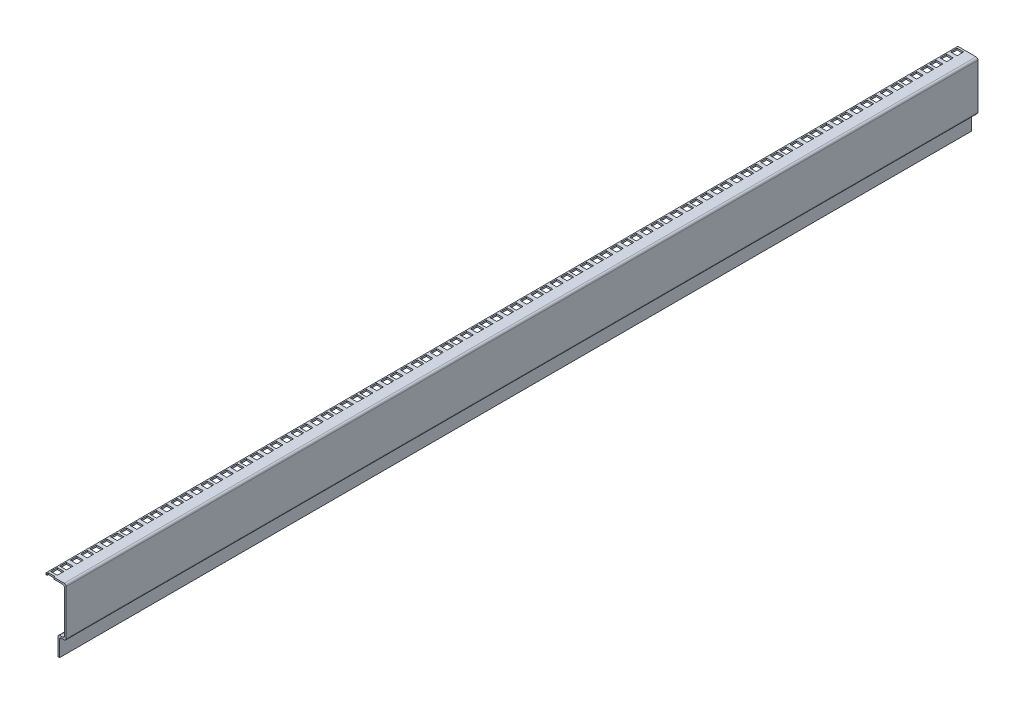
from build123d import *

# Parameters (mm, degrees)
SKETCH1_W            = 101.5
SKETCH1_H            = 1385.86
BOSS_EXTRUDE1_DEPTH  = 30.6
SKETCH2_W            = 28.1
SKETCH2_H            = 99
CUT_EXTRUDE1_DEPTH   = 1390.595401403
SKETCH3_W            = 1385.86
SKETCH3_H            = 29.5
BOSS_EXTRUDE2_DEPTH  = 10
SKETCH4_W            = 10
SKETCH4_H            = 27
CUT_EXTRUDE2_DEPTH   = 1390.595401403
SKETCH5_W            = 10
SKETCH5_H            = 474.14
CUT_EXTRUDE3_DEPTH   = 941.794180467
SKETCH37_W           = 10
SKETCH37_H           = 10
CUT_EXTRUDE35_DEPTH  = 941.794180467
SKETCH38_W           = 10
SKETCH38_H           = 10
CUT_EXTRUDE36_DEPTH  = 941.794180467
SKETCH39_W           = 10
SKETCH39_H           = 10
CUT_EXTRUDE37_DEPTH  = 941.794180467
SKETCH40_W           = 10
SKETCH40_H           = 10
CUT_EXTRUDE38_DEPTH  = 941.794180467
SKETCH41_W           = 10
SKETCH41_H           = 10
CUT_EXTRUDE39_DEPTH  = 941.794180467
SKETCH42_W           = 10
SKETCH42_H           = 10
CUT_EXTRUDE40_DEPTH  = 941.794180467
SKETCH43_W           = 10
SKETCH43_H           = 10
CUT_EXTRUDE41_DEPTH  = 941.794180467
SKETCH44_W           = 10
SKETCH44_H           = 10
CUT_EXTRUDE42_DEPTH  = 941.794180467
SKETCH45_W           = 10
SKETCH45_H           = 10
CUT_EXTRUDE43_DEPTH  = 941.794180467
SKETCH46_W           = 10
SKETCH46_H           = 10
CUT_EXTRUDE44_DEPTH  = 941.794180467
SKETCH47_W           = 10
SKETCH47_H           = 10
CUT_EXTRUDE45_DEPTH  = 941.794180467
SKETCH48_W           = 10
SKETCH48_H           = 10
CUT_EXTRUDE46_DEPTH  = 941.794180467
SKETCH49_W           = 10
SKETCH49_H           = 10
CUT_EXTRUDE47_DEPTH  = 941.794180467
SKETCH50_W           = 10
SKETCH50_H           = 10
CUT_EXTRUDE48_DEPTH  = 941.794180467
SKETCH51_W           = 10
SKETCH51_H           = 10
CUT_EXTRUDE49_DEPTH  = 941.794180467
SKETCH52_W           = 10
SKETCH52_H           = 10
CUT_EXTRUDE50_DEPTH  = 941.794180467
SKETCH53_W           = 10
SKETCH53_H           = 10
CUT_EXTRUDE51_DEPTH  = 941.794180467
SKETCH54_W           = 10
SKETCH54_H           = 10
CUT_EXTRUDE52_DEPTH  = 941.794180467
SKETCH55_W           = 10
SKETCH55_H           = 10
CUT_EXTRUDE53_DEPTH  = 941.794180467
SKETCH56_W           = 10
SKETCH56_H           = 10
CUT_EXTRUDE54_DEPTH  = 941.794180467
SKETCH57_W           = 10
SKETCH57_H           = 10
CUT_EXTRUDE55_DEPTH  = 941.794180467
SKETCH58_W           = 10
SKETCH58_H           = 10
CUT_EXTRUDE56_DEPTH  = 941.794180467
SKETCH59_W           = 10
SKETCH59_H           = 10
CUT_EXTRUDE57_DEPTH  = 941.794180467
SKETCH60_W           = 10
SKETCH60_H           = 10
CUT_EXTRUDE58_DEPTH  = 941.794180467
SKETCH61_W           = 10
SKETCH61_H           = 10
CUT_EXTRUDE59_DEPTH  = 941.794180467
SKETCH62_W           = 10
SKETCH62_H           = 10
CUT_EXTRUDE60_DEPTH  = 941.794180467
SKETCH63_W           = 10
SKETCH63_H           = 10
CUT_EXTRUDE61_DEPTH  = 941.794180467
SKETCH64_W           = 10
SKETCH64_H           = 10
CUT_EXTRUDE62_DEPTH  = 941.794180467
SKETCH65_W           = 10
SKETCH65_H           = 10
CUT_EXTRUDE63_DEPTH  = 941.794180467
SKETCH66_W           = 10
SKETCH66_H           = 10
CUT_EXTRUDE64_DEPTH  = 941.794180467
SKETCH67_W           = 10
SKETCH67_H           = 10
CUT_EXTRUDE65_DEPTH  = 941.794180467
SKETCH68_W           = 10
SKETCH68_H           = 10
CUT_EXTRUDE66_DEPTH  = 941.794180467
SKETCH69_W           = 10
SKETCH69_H           = 10
CUT_EXTRUDE67_DEPTH  = 941.794180467
SKETCH70_W           = 10
SKETCH70_H           = 10
CUT_EXTRUDE68_DEPTH  = 941.794180467
SKETCH71_W           = 10
SKETCH71_H           = 10
CUT_EXTRUDE69_DEPTH  = 941.794180467
SKETCH72_W           = 10
SKETCH72_H           = 10
CUT_EXTRUDE70_DEPTH  = 941.794180467
SKETCH73_W           = 10
SKETCH73_H           = 10
CUT_EXTRUDE71_DEPTH  = 941.794180467
SKETCH74_W           = 10
SKETCH74_H           = 10
CUT_EXTRUDE72_DEPTH  = 941.794180467
SKETCH75_W           = 10
SKETCH75_H           = 10
CUT_EXTRUDE73_DEPTH  = 941.794180467
SKETCH76_W           = 10
SKETCH76_H           = 10
CUT_EXTRUDE74_DEPTH  = 941.794180467
SKETCH77_W           = 10
SKETCH77_H           = 10
CUT_EXTRUDE75_DEPTH  = 941.794180467
SKETCH78_W           = 10
SKETCH78_H           = 10
CUT_EXTRUDE76_DEPTH  = 941.794180467
SKETCH79_W           = 10
SKETCH79_H           = 10
CUT_EXTRUDE77_DEPTH  = 941.794180467
SKETCH80_W           = 10
SKETCH80_H           = 10
CUT_EXTRUDE78_DEPTH  = 941.794180467
SKETCH81_W           = 10
SKETCH81_H           = 10
CUT_EXTRUDE79_DEPTH  = 941.794180467
SKETCH82_W           = 10
SKETCH82_H           = 10
CUT_EXTRUDE80_DEPTH  = 941.794180467
SKETCH83_W           = 10
SKETCH83_H           = 10
CUT_EXTRUDE81_DEPTH  = 941.794180467
SKETCH84_W           = 10
SKETCH84_H           = 10
CUT_EXTRUDE82_DEPTH  = 941.794180467
SKETCH85_W           = 10
SKETCH85_H           = 10
CUT_EXTRUDE83_DEPTH  = 941.794180467
SKETCH86_W           = 10
SKETCH86_H           = 10
CUT_EXTRUDE84_DEPTH  = 941.794180467
SKETCH87_W           = 10
SKETCH87_H           = 10
CUT_EXTRUDE85_DEPTH  = 941.794180467
SKETCH88_W           = 10
SKETCH88_H           = 10
CUT_EXTRUDE86_DEPTH  = 941.794180467
SKETCH89_W           = 10
SKETCH89_H           = 10
CUT_EXTRUDE87_DEPTH  = 941.794180467
SKETCH90_W           = 10
SKETCH90_H           = 10
CUT_EXTRUDE88_DEPTH  = 941.794180467
SKETCH91_W           = 10
SKETCH91_H           = 10
CUT_EXTRUDE89_DEPTH  = 941.794180467
SKETCH92_W           = 10
SKETCH92_H           = 10
CUT_EXTRUDE90_DEPTH  = 941.794180467
SKETCH93_W           = 10
SKETCH93_H           = 10
CUT_EXTRUDE91_DEPTH  = 941.794180467
SKETCH94_W           = 10
SKETCH94_H           = 10
CUT_EXTRUDE92_DEPTH  = 941.794180467
SKETCH95_W           = 10
SKETCH95_H           = 10
CUT_EXTRUDE93_DEPTH  = 941.794180467
SKETCH96_W           = 10
SKETCH96_H           = 10
CUT_EXTRUDE94_DEPTH  = 941.794180467
SKETCH97_W           = 10
SKETCH97_H           = 10
CUT_EXTRUDE95_DEPTH  = 941.794180467
SKETCH98_W           = 10
SKETCH98_H           = 10
CUT_EXTRUDE96_DEPTH  = 941.794180467
SKETCH99_W           = 10
SKETCH99_H           = 10
CUT_EXTRUDE97_DEPTH  = 941.794180467
SKETCH100_W          = 10
SKETCH100_H          = 10
CUT_EXTRUDE98_DEPTH  = 941.794180467
SKETCH101_W          = 10
SKETCH101_H          = 10
CUT_EXTRUDE99_DEPTH  = 941.794180467
SKETCH102_W          = 10
SKETCH102_H          = 10
CUT_EXTRUDE100_DEPTH = 941.794180467
SKETCH103_W          = 10
SKETCH103_H          = 10
CUT_EXTRUDE101_DEPTH = 941.794180467
SKETCH104_W          = 10
SKETCH104_H          = 10
CUT_EXTRUDE102_DEPTH = 941.794180467
SKETCH105_W          = 10
SKETCH105_H          = 10
CUT_EXTRUDE103_DEPTH = 941.794180467
SKETCH106_W          = 10
SKETCH106_H          = 10
CUT_EXTRUDE104_DEPTH = 941.794180467
SKETCH107_W          = 10
SKETCH107_H          = 10
CUT_EXTRUDE105_DEPTH = 941.794180467
SKETCH108_W          = 10
SKETCH108_H          = 10
CUT_EXTRUDE106_DEPTH = 941.794180467
SKETCH109_W          = 10
SKETCH109_H          = 10
CUT_EXTRUDE107_DEPTH = 941.794180467
SKETCH110_W          = 10
SKETCH110_H          = 10
CUT_EXTRUDE108_DEPTH = 941.794180467
SKETCH111_W          = 10
SKETCH111_H          = 10
CUT_EXTRUDE109_DEPTH = 941.794180467
SKETCH112_W          = 10
SKETCH112_H          = 10
CUT_EXTRUDE110_DEPTH = 941.794180467
SKETCH113_W          = 10
SKETCH113_H          = 10
CUT_EXTRUDE111_DEPTH = 941.794180467
SKETCH114_W          = 10
SKETCH114_H          = 10
CUT_EXTRUDE112_DEPTH = 941.794180467
SKETCH115_W          = 10
SKETCH115_H          = 10
CUT_EXTRUDE113_DEPTH = 941.794180467
SKETCH116_W          = 10
SKETCH116_H          = 10
CUT_EXTRUDE114_DEPTH = 941.794180467
SKETCH117_W          = 10
SKETCH117_H          = 10
CUT_EXTRUDE115_DEPTH = 941.794180467
SKETCH118_W          = 10
SKETCH118_H          = 10
CUT_EXTRUDE116_DEPTH = 941.794180467
SKETCH119_W          = 10
SKETCH119_H          = 10
CUT_EXTRUDE117_DEPTH = 941.794180467
SKETCH120_W          = 10
SKETCH120_H          = 10
CUT_EXTRUDE118_DEPTH = 941.794180467
SKETCH121_W          = 10
SKETCH121_H          = 10
CUT_EXTRUDE119_DEPTH = 941.794180467
SKETCH122_W          = 10
SKETCH122_H          = 10
CUT_EXTRUDE120_DEPTH = 941.794180467
SKETCH123_W          = 10
SKETCH123_H          = 10
CUT_EXTRUDE121_DEPTH = 941.794180467
SKETCH124_W          = 10
SKETCH124_H          = 10
CUT_EXTRUDE122_DEPTH = 941.794180467
SKETCH125_W          = 10
SKETCH125_H          = 10
CUT_EXTRUDE123_DEPTH = 941.794180467
SKETCH126_W          = 10
SKETCH126_H          = 10
CUT_EXTRUDE124_DEPTH = 941.794180467
SKETCH127_W          = 10
SKETCH127_H          = 10
CUT_EXTRUDE125_DEPTH = 941.527745471
FILLET1_R            = 3


with BuildPart() as part:
    # Sketch1 → Boss-Extrude1 (new body)
    with BuildSketch(Plane(origin=(-6.8, 0, 0), x_dir=(0, -1, 0), z_dir=(-1, 0, 0))):
        with Locations((48.25, -242.07)):
            Rectangle(SKETCH1_W, SKETCH1_H)
    extrude(amount=-BOSS_EXTRUDE1_DEPTH)

    # Sketch2 → Cut-Extrude1 (cut, through all)
    with BuildSketch(Plane(origin=(0, 0, -935), x_dir=(-1, 0, 0), z_dir=(0, 0, -1))):
        with Locations((-7.25, -49.5)):
            Rectangle(SKETCH2_W, SKETCH2_H)
    extrude(amount=-CUT_EXTRUDE1_DEPTH, mode=Mode.SUBTRACT)

    # Sketch3 → Boss-Extrude2 (add)
    with BuildSketch(Plane.ZY.offset(-21.3)):
        with Locations((-242.07, -84.25)):
            Rectangle(SKETCH3_W, SKETCH3_H)
    extrude(amount=BOSS_EXTRUDE2_DEPTH)

    # Sketch4 → Cut-Extrude2 (cut, through all)
    with BuildSketch(Plane.XY.offset(450.86)):
        with Locations((18.8, -85.5)):
            Rectangle(SKETCH4_W, SKETCH4_H)
    extrude(amount=-CUT_EXTRUDE2_DEPTH, mode=Mode.SUBTRACT)

    # Sketch5 → Cut-Extrude3 (cut, through all)
    with BuildSketch(Plane(origin=(0, 2.5, 0), x_dir=(-1, 0, 0), z_dir=(0, 1, 0))):
        with Locations((0, 686.08)):
            Rectangle(SKETCH5_W, SKETCH5_H)
    extrude(amount=-CUT_EXTRUDE3_DEPTH, mode=Mode.SUBTRACT)

    # Sketch37 → Cut-Extrude35 (cut, through all)
    with BuildSketch(Plane(origin=(0, 2.5, 0), x_dir=(-1, 0, 0), z_dir=(0, 1, 0))):
        with Locations((0, 440.546341463)):
            Rectangle(SKETCH37_W, SKETCH37_H)
    extrude(amount=-CUT_EXTRUDE35_DEPTH, mode=Mode.SUBTRACT)

    # Sketch38 → Cut-Extrude36 (cut, through all)
    with BuildSketch(Plane(origin=(0, 2.5, 0), x_dir=(-1, 0, 0), z_dir=(0, 1, 0))):
        with Locations((0, 426.71097561)):
            Rectangle(SKETCH38_W, SKETCH38_H)
    extrude(amount=-CUT_EXTRUDE36_DEPTH, mode=Mode.SUBTRACT)

    # Sketch39 → Cut-Extrude37 (cut, through all)
    with BuildSketch(Plane(origin=(0, 2.5, 0), x_dir=(-1, 0, 0), z_dir=(0, 1, 0))):
        with Locations((0, 410.83597561)):
            Rectangle(SKETCH39_W, SKETCH39_H)
    extrude(amount=-CUT_EXTRUDE37_DEPTH, mode=Mode.SUBTRACT)

    # Sketch40 → Cut-Extrude38 (cut, through all)
    with BuildSketch(Plane(origin=(0, 2.5, 0), x_dir=(-1, 0, 0), z_dir=(0, 1, 0))):
        with Locations((0, 394.96097561)):
            Rectangle(SKETCH40_W, SKETCH40_H)
    extrude(amount=-CUT_EXTRUDE38_DEPTH, mode=Mode.SUBTRACT)

    # Sketch41 → Cut-Extrude39 (cut, through all)
    with BuildSketch(Plane(origin=(0, 2.5, 0), x_dir=(-1, 0, 0), z_dir=(0, 1, 0))):
        with Locations((0, 381.125609756)):
            Rectangle(SKETCH41_W, SKETCH41_H)
    extrude(amount=-CUT_EXTRUDE39_DEPTH, mode=Mode.SUBTRACT)

    # Sketch42 → Cut-Extrude40 (cut, through all)
    with BuildSketch(Plane(origin=(0, 2.5, 0), x_dir=(-1, 0, 0), z_dir=(0, 1, 0))):
        with Locations((0, 365.250609756)):
            Rectangle(SKETCH42_W, SKETCH42_H)
    extrude(amount=-CUT_EXTRUDE40_DEPTH, mode=Mode.SUBTRACT)

    # Sketch43 → Cut-Extrude41 (cut, through all)
    with BuildSketch(Plane(origin=(0, 2.5, 0), x_dir=(-1, 0, 0), z_dir=(0, 1, 0))):
        with Locations((0, 349.375609756)):
            Rectangle(SKETCH43_W, SKETCH43_H)
    extrude(amount=-CUT_EXTRUDE41_DEPTH, mode=Mode.SUBTRACT)

    # Sketch44 → Cut-Extrude42 (cut, through all)
    with BuildSketch(Plane(origin=(0, 2.5, 0), x_dir=(-1, 0, 0), z_dir=(0, 1, 0))):
        with Locations((0, 335.540243902)):
            Rectangle(SKETCH44_W, SKETCH44_H)
    extrude(amount=-CUT_EXTRUDE42_DEPTH, mode=Mode.SUBTRACT)

    # Sketch45 → Cut-Extrude43 (cut, through all)
    with BuildSketch(Plane(origin=(0, 2.5, 0), x_dir=(-1, 0, 0), z_dir=(0, 1, 0))):
        with Locations((0, 319.665243902)):
            Rectangle(SKETCH45_W, SKETCH45_H)
    extrude(amount=-CUT_EXTRUDE43_DEPTH, mode=Mode.SUBTRACT)

    # Sketch46 → Cut-Extrude44 (cut, through all)
    with BuildSketch(Plane(origin=(0, 2.5, 0), x_dir=(-1, 0, 0), z_dir=(0, 1, 0))):
        with Locations((0, 303.790243902)):
            Rectangle(SKETCH46_W, SKETCH46_H)
    extrude(amount=-CUT_EXTRUDE44_DEPTH, mode=Mode.SUBTRACT)

    # Sketch47 → Cut-Extrude45 (cut, through all)
    with BuildSketch(Plane(origin=(0, 2.5, 0), x_dir=(-1, 0, 0), z_dir=(0, 1, 0))):
        with Locations((0, 289.954878049)):
            Rectangle(SKETCH47_W, SKETCH47_H)
    extrude(amount=-CUT_EXTRUDE45_DEPTH, mode=Mode.SUBTRACT)

    # Sketch48 → Cut-Extrude46 (cut, through all)
    with BuildSketch(Plane(origin=(0, 2.5, 0), x_dir=(-1, 0, 0), z_dir=(0, 1, 0))):
        with Locations((0, 274.079878049)):
            Rectangle(SKETCH48_W, SKETCH48_H)
    extrude(amount=-CUT_EXTRUDE46_DEPTH, mode=Mode.SUBTRACT)

    # Sketch49 → Cut-Extrude47 (cut, through all)
    with BuildSketch(Plane(origin=(0, 2.5, 0), x_dir=(-1, 0, 0), z_dir=(0, 1, 0))):
        with Locations((0, 258.204878049)):
            Rectangle(SKETCH49_W, SKETCH49_H)
    extrude(amount=-CUT_EXTRUDE47_DEPTH, mode=Mode.SUBTRACT)

    # Sketch50 → Cut-Extrude48 (cut, through all)
    with BuildSketch(Plane(origin=(0, 2.5, 0), x_dir=(-1, 0, 0), z_dir=(0, 1, 0))):
        with Locations((0, 244.369512195)):
            Rectangle(SKETCH50_W, SKETCH50_H)
    extrude(amount=-CUT_EXTRUDE48_DEPTH, mode=Mode.SUBTRACT)

    # Sketch51 → Cut-Extrude49 (cut, through all)
    with BuildSketch(Plane(origin=(0, 2.5, 0), x_dir=(-1, 0, 0), z_dir=(0, 1, 0))):
        with Locations((0, 228.494512195)):
            Rectangle(SKETCH51_W, SKETCH51_H)
    extrude(amount=-CUT_EXTRUDE49_DEPTH, mode=Mode.SUBTRACT)

    # Sketch52 → Cut-Extrude50 (cut, through all)
    with BuildSketch(Plane(origin=(0, 2.5, 0), x_dir=(-1, 0, 0), z_dir=(0, 1, 0))):
        with Locations((0, 212.619512195)):
            Rectangle(SKETCH52_W, SKETCH52_H)
    extrude(amount=-CUT_EXTRUDE50_DEPTH, mode=Mode.SUBTRACT)

    # Sketch53 → Cut-Extrude51 (cut, through all)
    with BuildSketch(Plane(origin=(0, 2.5, 0), x_dir=(-1, 0, 0), z_dir=(0, 1, 0))):
        with Locations((0, 198.784146341)):
            Rectangle(SKETCH53_W, SKETCH53_H)
    extrude(amount=-CUT_EXTRUDE51_DEPTH, mode=Mode.SUBTRACT)

    # Sketch54 → Cut-Extrude52 (cut, through all)
    with BuildSketch(Plane(origin=(0, 2.5, 0), x_dir=(-1, 0, 0), z_dir=(0, 1, 0))):
        with Locations((0, 182.909146341)):
            Rectangle(SKETCH54_W, SKETCH54_H)
    extrude(amount=-CUT_EXTRUDE52_DEPTH, mode=Mode.SUBTRACT)

    # Sketch55 → Cut-Extrude53 (cut, through all)
    with BuildSketch(Plane(origin=(0, 2.5, 0), x_dir=(-1, 0, 0), z_dir=(0, 1, 0))):
        with Locations((0, 167.034146341)):
            Rectangle(SKETCH55_W, SKETCH55_H)
    extrude(amount=-CUT_EXTRUDE53_DEPTH, mode=Mode.SUBTRACT)

    # Sketch56 → Cut-Extrude54 (cut, through all)
    with BuildSketch(Plane(origin=(0, 2.5, 0), x_dir=(-1, 0, 0), z_dir=(0, 1, 0))):
        with Locations((0, 153.198780488)):
            Rectangle(SKETCH56_W, SKETCH56_H)
    extrude(amount=-CUT_EXTRUDE54_DEPTH, mode=Mode.SUBTRACT)

    # Sketch57 → Cut-Extrude55 (cut, through all)
    with BuildSketch(Plane(origin=(0, 2.5, 0), x_dir=(-1, 0, 0), z_dir=(0, 1, 0))):
        with Locations((0, 137.323780488)):
            Rectangle(SKETCH57_W, SKETCH57_H)
    extrude(amount=-CUT_EXTRUDE55_DEPTH, mode=Mode.SUBTRACT)

    # Sketch58 → Cut-Extrude56 (cut, through all)
    with BuildSketch(Plane(origin=(0, 2.5, 0), x_dir=(-1, 0, 0), z_dir=(0, 1, 0))):
        with Locations((0, 121.448780488)):
            Rectangle(SKETCH58_W, SKETCH58_H)
    extrude(amount=-CUT_EXTRUDE56_DEPTH, mode=Mode.SUBTRACT)

    # Sketch59 → Cut-Extrude57 (cut, through all)
    with BuildSketch(Plane(origin=(0, 2.5, 0), x_dir=(-1, 0, 0), z_dir=(0, 1, 0))):
        with Locations((0, 107.613414634)):
            Rectangle(SKETCH59_W, SKETCH59_H)
    extrude(amount=-CUT_EXTRUDE57_DEPTH, mode=Mode.SUBTRACT)

    # Sketch60 → Cut-Extrude58 (cut, through all)
    with BuildSketch(Plane(origin=(0, 2.5, 0), x_dir=(-1, 0, 0), z_dir=(0, 1, 0))):
        with Locations((0, 91.738414634)):
            Rectangle(SKETCH60_W, SKETCH60_H)
    extrude(amount=-CUT_EXTRUDE58_DEPTH, mode=Mode.SUBTRACT)

    # Sketch61 → Cut-Extrude59 (cut, through all)
    with BuildSketch(Plane(origin=(0, 2.5, 0), x_dir=(-1, 0, 0), z_dir=(0, 1, 0))):
        with Locations((0, 75.863414634)):
            Rectangle(SKETCH61_W, SKETCH61_H)
    extrude(amount=-CUT_EXTRUDE59_DEPTH, mode=Mode.SUBTRACT)

    # Sketch62 → Cut-Extrude60 (cut, through all)
    with BuildSketch(Plane(origin=(0, 2.5, 0), x_dir=(-1, 0, 0), z_dir=(0, 1, 0))):
        with Locations((0, 62.02804878)):
            Rectangle(SKETCH62_W, SKETCH62_H)
    extrude(amount=-CUT_EXTRUDE60_DEPTH, mode=Mode.SUBTRACT)

    # Sketch63 → Cut-Extrude61 (cut, through all)
    with BuildSketch(Plane(origin=(0, 2.5, 0), x_dir=(-1, 0, 0), z_dir=(0, 1, 0))):
        with Locations((0, 46.15304878)):
            Rectangle(SKETCH63_W, SKETCH63_H)
    extrude(amount=-CUT_EXTRUDE61_DEPTH, mode=Mode.SUBTRACT)

    # Sketch64 → Cut-Extrude62 (cut, through all)
    with BuildSketch(Plane(origin=(0, 2.5, 0), x_dir=(-1, 0, 0), z_dir=(0, 1, 0))):
        with Locations((0, 30.27804878)):
            Rectangle(SKETCH64_W, SKETCH64_H)
    extrude(amount=-CUT_EXTRUDE62_DEPTH, mode=Mode.SUBTRACT)

    # Sketch65 → Cut-Extrude63 (cut, through all)
    with BuildSketch(Plane(origin=(0, 2.5, 0), x_dir=(-1, 0, 0), z_dir=(0, 1, 0))):
        with Locations((0, 16.442682927)):
            Rectangle(SKETCH65_W, SKETCH65_H)
    extrude(amount=-CUT_EXTRUDE63_DEPTH, mode=Mode.SUBTRACT)

    # Sketch66 → Cut-Extrude64 (cut, through all)
    with BuildSketch(Plane(origin=(0, 2.5, 0), x_dir=(-1, 0, 0), z_dir=(0, 1, 0))):
        with Locations((0, 0.567682927)):
            Rectangle(SKETCH66_W, SKETCH66_H)
    extrude(amount=-CUT_EXTRUDE64_DEPTH, mode=Mode.SUBTRACT)

    # Sketch67 → Cut-Extrude65 (cut, through all)
    with BuildSketch(Plane(origin=(0, 2.5, 0), x_dir=(-1, 0, 0), z_dir=(0, 1, 0))):
        with Locations((0, -29.142682927)):
            Rectangle(SKETCH67_W, SKETCH67_H)
    extrude(amount=-CUT_EXTRUDE65_DEPTH, mode=Mode.SUBTRACT)

    # Sketch68 → Cut-Extrude66 (cut, through all)
    with BuildSketch(Plane(origin=(0, 2.5, 0), x_dir=(-1, 0, 0), z_dir=(0, 1, 0))):
        with Locations((0, -45.017682927)):
            Rectangle(SKETCH68_W, SKETCH68_H)
    extrude(amount=-CUT_EXTRUDE66_DEPTH, mode=Mode.SUBTRACT)

    # Sketch69 → Cut-Extrude67 (cut, through all)
    with BuildSketch(Plane(origin=(0, 2.5, 0), x_dir=(-1, 0, 0), z_dir=(0, 1, 0))):
        with Locations((0, -60.892682927)):
            Rectangle(SKETCH69_W, SKETCH69_H)
    extrude(amount=-CUT_EXTRUDE67_DEPTH, mode=Mode.SUBTRACT)

    # Sketch70 → Cut-Extrude68 (cut, through all)
    with BuildSketch(Plane(origin=(0, 2.5, 0), x_dir=(-1, 0, 0), z_dir=(0, 1, 0))):
        with Locations((0, -74.72804878)):
            Rectangle(SKETCH70_W, SKETCH70_H)
    extrude(amount=-CUT_EXTRUDE68_DEPTH, mode=Mode.SUBTRACT)

    # Sketch71 → Cut-Extrude69 (cut, through all)
    with BuildSketch(Plane(origin=(0, 2.5, 0), x_dir=(-1, 0, 0), z_dir=(0, 1, 0))):
        with Locations((0, -90.60304878)):
            Rectangle(SKETCH71_W, SKETCH71_H)
    extrude(amount=-CUT_EXTRUDE69_DEPTH, mode=Mode.SUBTRACT)

    # Sketch72 → Cut-Extrude70 (cut, through all)
    with BuildSketch(Plane(origin=(0, 2.5, 0), x_dir=(-1, 0, 0), z_dir=(0, 1, 0))):
        with Locations((0, -106.47804878)):
            Rectangle(SKETCH72_W, SKETCH72_H)
    extrude(amount=-CUT_EXTRUDE70_DEPTH, mode=Mode.SUBTRACT)

    # Sketch73 → Cut-Extrude71 (cut, through all)
    with BuildSketch(Plane(origin=(0, 2.5, 0), x_dir=(-1, 0, 0), z_dir=(0, 1, 0))):
        with Locations((0, -120.313414634)):
            Rectangle(SKETCH73_W, SKETCH73_H)
    extrude(amount=-CUT_EXTRUDE71_DEPTH, mode=Mode.SUBTRACT)

    # Sketch74 → Cut-Extrude72 (cut, through all)
    with BuildSketch(Plane(origin=(0, 2.5, 0), x_dir=(-1, 0, 0), z_dir=(0, 1, 0))):
        with Locations((0, -136.188414634)):
            Rectangle(SKETCH74_W, SKETCH74_H)
    extrude(amount=-CUT_EXTRUDE72_DEPTH, mode=Mode.SUBTRACT)

    # Sketch75 → Cut-Extrude73 (cut, through all)
    with BuildSketch(Plane(origin=(0, 2.5, 0), x_dir=(-1, 0, 0), z_dir=(0, 1, 0))):
        with Locations((0, -152.063414634)):
            Rectangle(SKETCH75_W, SKETCH75_H)
    extrude(amount=-CUT_EXTRUDE73_DEPTH, mode=Mode.SUBTRACT)

    # Sketch76 → Cut-Extrude74 (cut, through all)
    with BuildSketch(Plane(origin=(0, 2.5, 0), x_dir=(-1, 0, 0), z_dir=(0, 1, 0))):
        with Locations((0, -165.898780488)):
            Rectangle(SKETCH76_W, SKETCH76_H)
    extrude(amount=-CUT_EXTRUDE74_DEPTH, mode=Mode.SUBTRACT)

    # Sketch77 → Cut-Extrude75 (cut, through all)
    with BuildSketch(Plane(origin=(0, 2.5, 0), x_dir=(-1, 0, 0), z_dir=(0, 1, 0))):
        with Locations((0, -181.773780488)):
            Rectangle(SKETCH77_W, SKETCH77_H)
    extrude(amount=-CUT_EXTRUDE75_DEPTH, mode=Mode.SUBTRACT)

    # Sketch78 → Cut-Extrude76 (cut, through all)
    with BuildSketch(Plane(origin=(0, 2.5, 0), x_dir=(-1, 0, 0), z_dir=(0, 1, 0))):
        with Locations((0, -197.648780488)):
            Rectangle(SKETCH78_W, SKETCH78_H)
    extrude(amount=-CUT_EXTRUDE76_DEPTH, mode=Mode.SUBTRACT)

    # Sketch79 → Cut-Extrude77 (cut, through all)
    with BuildSketch(Plane(origin=(0, 2.5, 0), x_dir=(-1, 0, 0), z_dir=(0, 1, 0))):
        with Locations((0, -211.484146341)):
            Rectangle(SKETCH79_W, SKETCH79_H)
    extrude(amount=-CUT_EXTRUDE77_DEPTH, mode=Mode.SUBTRACT)

    # Sketch80 → Cut-Extrude78 (cut, through all)
    with BuildSketch(Plane(origin=(0, 2.5, 0), x_dir=(-1, 0, 0), z_dir=(0, 1, 0))):
        with Locations((0, -227.359146341)):
            Rectangle(SKETCH80_W, SKETCH80_H)
    extrude(amount=-CUT_EXTRUDE78_DEPTH, mode=Mode.SUBTRACT)

    # Sketch81 → Cut-Extrude79 (cut, through all)
    with BuildSketch(Plane(origin=(0, 2.5, 0), x_dir=(-1, 0, 0), z_dir=(0, 1, 0))):
        with Locations((0, -243.234146341)):
            Rectangle(SKETCH81_W, SKETCH81_H)
    extrude(amount=-CUT_EXTRUDE79_DEPTH, mode=Mode.SUBTRACT)

    # Sketch82 → Cut-Extrude80 (cut, through all)
    with BuildSketch(Plane(origin=(0, 2.5, 0), x_dir=(-1, 0, 0), z_dir=(0, 1, 0))):
        with Locations((0, -257.069512195)):
            Rectangle(SKETCH82_W, SKETCH82_H)
    extrude(amount=-CUT_EXTRUDE80_DEPTH, mode=Mode.SUBTRACT)

    # Sketch83 → Cut-Extrude81 (cut, through all)
    with BuildSketch(Plane(origin=(0, 2.5, 0), x_dir=(-1, 0, 0), z_dir=(0, 1, 0))):
        with Locations((0, -272.944512195)):
            Rectangle(SKETCH83_W, SKETCH83_H)
    extrude(amount=-CUT_EXTRUDE81_DEPTH, mode=Mode.SUBTRACT)

    # Sketch84 → Cut-Extrude82 (cut, through all)
    with BuildSketch(Plane(origin=(0, 2.5, 0), x_dir=(-1, 0, 0), z_dir=(0, 1, 0))):
        with Locations((0, -288.819512195)):
            Rectangle(SKETCH84_W, SKETCH84_H)
    extrude(amount=-CUT_EXTRUDE82_DEPTH, mode=Mode.SUBTRACT)

    # Sketch85 → Cut-Extrude83 (cut, through all)
    with BuildSketch(Plane(origin=(0, 2.5, 0), x_dir=(-1, 0, 0), z_dir=(0, 1, 0))):
        with Locations((0, -302.654878049)):
            Rectangle(SKETCH85_W, SKETCH85_H)
    extrude(amount=-CUT_EXTRUDE83_DEPTH, mode=Mode.SUBTRACT)

    # Sketch86 → Cut-Extrude84 (cut, through all)
    with BuildSketch(Plane(origin=(0, 2.5, 0), x_dir=(-1, 0, 0), z_dir=(0, 1, 0))):
        with Locations((0, -318.529878049)):
            Rectangle(SKETCH86_W, SKETCH86_H)
    extrude(amount=-CUT_EXTRUDE84_DEPTH, mode=Mode.SUBTRACT)

    # Sketch87 → Cut-Extrude85 (cut, through all)
    with BuildSketch(Plane(origin=(0, 2.5, 0), x_dir=(-1, 0, 0), z_dir=(0, 1, 0))):
        with Locations((0, -334.404878049)):
            Rectangle(SKETCH87_W, SKETCH87_H)
    extrude(amount=-CUT_EXTRUDE85_DEPTH, mode=Mode.SUBTRACT)

    # Sketch88 → Cut-Extrude86 (cut, through all)
    with BuildSketch(Plane(origin=(0, 2.5, 0), x_dir=(-1, 0, 0), z_dir=(0, 1, 0))):
        with Locations((0, -348.240243902)):
            Rectangle(SKETCH88_W, SKETCH88_H)
    extrude(amount=-CUT_EXTRUDE86_DEPTH, mode=Mode.SUBTRACT)

    # Sketch89 → Cut-Extrude87 (cut, through all)
    with BuildSketch(Plane(origin=(0, 2.5, 0), x_dir=(-1, 0, 0), z_dir=(0, 1, 0))):
        with Locations((0, -364.115243902)):
            Rectangle(SKETCH89_W, SKETCH89_H)
    extrude(amount=-CUT_EXTRUDE87_DEPTH, mode=Mode.SUBTRACT)

    # Sketch90 → Cut-Extrude88 (cut, through all)
    with BuildSketch(Plane(origin=(0, 2.5, 0), x_dir=(-1, 0, 0), z_dir=(0, 1, 0))):
        with Locations((0, -379.990243902)):
            Rectangle(SKETCH90_W, SKETCH90_H)
    extrude(amount=-CUT_EXTRUDE88_DEPTH, mode=Mode.SUBTRACT)

    # Sketch91 → Cut-Extrude89 (cut, through all)
    with BuildSketch(Plane(origin=(0, 2.5, 0), x_dir=(-1, 0, 0), z_dir=(0, 1, 0))):
        with Locations((0, -393.825609756)):
            Rectangle(SKETCH91_W, SKETCH91_H)
    extrude(amount=-CUT_EXTRUDE89_DEPTH, mode=Mode.SUBTRACT)

    # Sketch92 → Cut-Extrude90 (cut, through all)
    with BuildSketch(Plane(origin=(0, 2.5, 0), x_dir=(-1, 0, 0), z_dir=(0, 1, 0))):
        with Locations((0, -409.700609756)):
            Rectangle(SKETCH92_W, SKETCH92_H)
    extrude(amount=-CUT_EXTRUDE90_DEPTH, mode=Mode.SUBTRACT)

    # Sketch93 → Cut-Extrude91 (cut, through all)
    with BuildSketch(Plane(origin=(0, 2.5, 0), x_dir=(-1, 0, 0), z_dir=(0, 1, 0))):
        with Locations((0, -425.575609756)):
            Rectangle(SKETCH93_W, SKETCH93_H)
    extrude(amount=-CUT_EXTRUDE91_DEPTH, mode=Mode.SUBTRACT)

    # Sketch94 → Cut-Extrude92 (cut, through all)
    with BuildSketch(Plane(origin=(0, 2.5, 0), x_dir=(-1, 0, 0), z_dir=(0, 1, 0))):
        with Locations((0, -439.41097561)):
            Rectangle(SKETCH94_W, SKETCH94_H)
    extrude(amount=-CUT_EXTRUDE92_DEPTH, mode=Mode.SUBTRACT)

    # Sketch95 → Cut-Extrude93 (cut, through all)
    with BuildSketch(Plane(origin=(0, 2.5, 0), x_dir=(-1, 0, 0), z_dir=(0, 1, 0))):
        with Locations((0, -455.28597561)):
            Rectangle(SKETCH95_W, SKETCH95_H)
    extrude(amount=-CUT_EXTRUDE93_DEPTH, mode=Mode.SUBTRACT)

    # Sketch96 → Cut-Extrude94 (cut, through all)
    with BuildSketch(Plane(origin=(0, 2.5, 0), x_dir=(-1, 0, 0), z_dir=(0, 1, 0))):
        with Locations((0, -471.16097561)):
            Rectangle(SKETCH96_W, SKETCH96_H)
    extrude(amount=-CUT_EXTRUDE94_DEPTH, mode=Mode.SUBTRACT)

    # Sketch97 → Cut-Extrude95 (cut, through all)
    with BuildSketch(Plane(origin=(0, 2.5, 0), x_dir=(-1, 0, 0), z_dir=(0, 1, 0))):
        with Locations((0, -484.996341463)):
            Rectangle(SKETCH97_W, SKETCH97_H)
    extrude(amount=-CUT_EXTRUDE95_DEPTH, mode=Mode.SUBTRACT)

    # Sketch98 → Cut-Extrude96 (cut, through all)
    with BuildSketch(Plane(origin=(0, 2.5, 0), x_dir=(-1, 0, 0), z_dir=(0, 1, 0))):
        with Locations((0, -500.871341463)):
            Rectangle(SKETCH98_W, SKETCH98_H)
    extrude(amount=-CUT_EXTRUDE96_DEPTH, mode=Mode.SUBTRACT)

    # Sketch99 → Cut-Extrude97 (cut, through all)
    with BuildSketch(Plane(origin=(0, 2.5, 0), x_dir=(-1, 0, 0), z_dir=(0, 1, 0))):
        with Locations((0, -516.746341463)):
            Rectangle(SKETCH99_W, SKETCH99_H)
    extrude(amount=-CUT_EXTRUDE97_DEPTH, mode=Mode.SUBTRACT)

    # Sketch100 → Cut-Extrude98 (cut, through all)
    with BuildSketch(Plane(origin=(0, 2.5, 0), x_dir=(-1, 0, 0), z_dir=(0, 1, 0))):
        with Locations((0, -530.581707317)):
            Rectangle(SKETCH100_W, SKETCH100_H)
    extrude(amount=-CUT_EXTRUDE98_DEPTH, mode=Mode.SUBTRACT)

    # Sketch101 → Cut-Extrude99 (cut, through all)
    with BuildSketch(Plane(origin=(0, 2.5, 0), x_dir=(-1, 0, 0), z_dir=(0, 1, 0))):
        with Locations((0, -546.456707317)):
            Rectangle(SKETCH101_W, SKETCH101_H)
    extrude(amount=-CUT_EXTRUDE99_DEPTH, mode=Mode.SUBTRACT)

    # Sketch102 → Cut-Extrude100 (cut, through all)
    with BuildSketch(Plane(origin=(0, 2.5, 0), x_dir=(-1, 0, 0), z_dir=(0, 1, 0))):
        with Locations((0, -562.331707317)):
            Rectangle(SKETCH102_W, SKETCH102_H)
    extrude(amount=-CUT_EXTRUDE100_DEPTH, mode=Mode.SUBTRACT)

    # Sketch103 → Cut-Extrude101 (cut, through all)
    with BuildSketch(Plane(origin=(0, 2.5, 0), x_dir=(-1, 0, 0), z_dir=(0, 1, 0))):
        with Locations((0, -576.167073171)):
            Rectangle(SKETCH103_W, SKETCH103_H)
    extrude(amount=-CUT_EXTRUDE101_DEPTH, mode=Mode.SUBTRACT)

    # Sketch104 → Cut-Extrude102 (cut, through all)
    with BuildSketch(Plane(origin=(0, 2.5, 0), x_dir=(-1, 0, 0), z_dir=(0, 1, 0))):
        with Locations((0, -592.042073171)):
            Rectangle(SKETCH104_W, SKETCH104_H)
    extrude(amount=-CUT_EXTRUDE102_DEPTH, mode=Mode.SUBTRACT)

    # Sketch105 → Cut-Extrude103 (cut, through all)
    with BuildSketch(Plane(origin=(0, 2.5, 0), x_dir=(-1, 0, 0), z_dir=(0, 1, 0))):
        with Locations((0, -607.917073171)):
            Rectangle(SKETCH105_W, SKETCH105_H)
    extrude(amount=-CUT_EXTRUDE103_DEPTH, mode=Mode.SUBTRACT)

    # Sketch106 → Cut-Extrude104 (cut, through all)
    with BuildSketch(Plane(origin=(0, 2.5, 0), x_dir=(-1, 0, 0), z_dir=(0, 1, 0))):
        with Locations((0, -621.752439024)):
            Rectangle(SKETCH106_W, SKETCH106_H)
    extrude(amount=-CUT_EXTRUDE104_DEPTH, mode=Mode.SUBTRACT)

    # Sketch107 → Cut-Extrude105 (cut, through all)
    with BuildSketch(Plane(origin=(0, 2.5, 0), x_dir=(-1, 0, 0), z_dir=(0, 1, 0))):
        with Locations((0, -637.627439024)):
            Rectangle(SKETCH107_W, SKETCH107_H)
    extrude(amount=-CUT_EXTRUDE105_DEPTH, mode=Mode.SUBTRACT)

    # Sketch108 → Cut-Extrude106 (cut, through all)
    with BuildSketch(Plane(origin=(0, 2.5, 0), x_dir=(-1, 0, 0), z_dir=(0, 1, 0))):
        with Locations((0, -653.502439024)):
            Rectangle(SKETCH108_W, SKETCH108_H)
    extrude(amount=-CUT_EXTRUDE106_DEPTH, mode=Mode.SUBTRACT)

    # Sketch109 → Cut-Extrude107 (cut, through all)
    with BuildSketch(Plane(origin=(0, 2.5, 0), x_dir=(-1, 0, 0), z_dir=(0, 1, 0))):
        with Locations((0, -667.337804878)):
            Rectangle(SKETCH109_W, SKETCH109_H)
    extrude(amount=-CUT_EXTRUDE107_DEPTH, mode=Mode.SUBTRACT)

    # Sketch110 → Cut-Extrude108 (cut, through all)
    with BuildSketch(Plane(origin=(0, 2.5, 0), x_dir=(-1, 0, 0), z_dir=(0, 1, 0))):
        with Locations((0, -683.212804878)):
            Rectangle(SKETCH110_W, SKETCH110_H)
    extrude(amount=-CUT_EXTRUDE108_DEPTH, mode=Mode.SUBTRACT)

    # Sketch111 → Cut-Extrude109 (cut, through all)
    with BuildSketch(Plane(origin=(0, 2.5, 0), x_dir=(-1, 0, 0), z_dir=(0, 1, 0))):
        with Locations((0, -699.087804878)):
            Rectangle(SKETCH111_W, SKETCH111_H)
    extrude(amount=-CUT_EXTRUDE109_DEPTH, mode=Mode.SUBTRACT)

    # Sketch112 → Cut-Extrude110 (cut, through all)
    with BuildSketch(Plane(origin=(0, 2.5, 0), x_dir=(-1, 0, 0), z_dir=(0, 1, 0))):
        with Locations((0, -712.923170732)):
            Rectangle(SKETCH112_W, SKETCH112_H)
    extrude(amount=-CUT_EXTRUDE110_DEPTH, mode=Mode.SUBTRACT)

    # Sketch113 → Cut-Extrude111 (cut, through all)
    with BuildSketch(Plane(origin=(0, 2.5, 0), x_dir=(-1, 0, 0), z_dir=(0, 1, 0))):
        with Locations((0, -728.798170732)):
            Rectangle(SKETCH113_W, SKETCH113_H)
    extrude(amount=-CUT_EXTRUDE111_DEPTH, mode=Mode.SUBTRACT)

    # Sketch114 → Cut-Extrude112 (cut, through all)
    with BuildSketch(Plane(origin=(0, 2.5, 0), x_dir=(-1, 0, 0), z_dir=(0, 1, 0))):
        with Locations((0, -744.673170732)):
            Rectangle(SKETCH114_W, SKETCH114_H)
    extrude(amount=-CUT_EXTRUDE112_DEPTH, mode=Mode.SUBTRACT)

    # Sketch115 → Cut-Extrude113 (cut, through all)
    with BuildSketch(Plane(origin=(0, 2.5, 0), x_dir=(-1, 0, 0), z_dir=(0, 1, 0))):
        with Locations((0, -758.508536585)):
            Rectangle(SKETCH115_W, SKETCH115_H)
    extrude(amount=-CUT_EXTRUDE113_DEPTH, mode=Mode.SUBTRACT)

    # Sketch116 → Cut-Extrude114 (cut, through all)
    with BuildSketch(Plane(origin=(0, 2.5, 0), x_dir=(-1, 0, 0), z_dir=(0, 1, 0))):
        with Locations((0, -774.383536585)):
            Rectangle(SKETCH116_W, SKETCH116_H)
    extrude(amount=-CUT_EXTRUDE114_DEPTH, mode=Mode.SUBTRACT)

    # Sketch117 → Cut-Extrude115 (cut, through all)
    with BuildSketch(Plane(origin=(0, 2.5, 0), x_dir=(-1, 0, 0), z_dir=(0, 1, 0))):
        with Locations((0, -790.258536585)):
            Rectangle(SKETCH117_W, SKETCH117_H)
    extrude(amount=-CUT_EXTRUDE115_DEPTH, mode=Mode.SUBTRACT)

    # Sketch118 → Cut-Extrude116 (cut, through all)
    with BuildSketch(Plane(origin=(0, 2.5, 0), x_dir=(-1, 0, 0), z_dir=(0, 1, 0))):
        with Locations((0, -804.093902439)):
            Rectangle(SKETCH118_W, SKETCH118_H)
    extrude(amount=-CUT_EXTRUDE116_DEPTH, mode=Mode.SUBTRACT)

    # Sketch119 → Cut-Extrude117 (cut, through all)
    with BuildSketch(Plane(origin=(0, 2.5, 0), x_dir=(-1, 0, 0), z_dir=(0, 1, 0))):
        with Locations((0, -819.968902439)):
            Rectangle(SKETCH119_W, SKETCH119_H)
    extrude(amount=-CUT_EXTRUDE117_DEPTH, mode=Mode.SUBTRACT)

    # Sketch120 → Cut-Extrude118 (cut, through all)
    with BuildSketch(Plane(origin=(0, 2.5, 0), x_dir=(-1, 0, 0), z_dir=(0, 1, 0))):
        with Locations((0, -835.843902439)):
            Rectangle(SKETCH120_W, SKETCH120_H)
    extrude(amount=-CUT_EXTRUDE118_DEPTH, mode=Mode.SUBTRACT)

    # Sketch121 → Cut-Extrude119 (cut, through all)
    with BuildSketch(Plane(origin=(0, 2.5, 0), x_dir=(-1, 0, 0), z_dir=(0, 1, 0))):
        with Locations((0, -849.679268293)):
            Rectangle(SKETCH121_W, SKETCH121_H)
    extrude(amount=-CUT_EXTRUDE119_DEPTH, mode=Mode.SUBTRACT)

    # Sketch122 → Cut-Extrude120 (cut, through all)
    with BuildSketch(Plane(origin=(0, 2.5, 0), x_dir=(-1, 0, 0), z_dir=(0, 1, 0))):
        with Locations((0, -865.554268293)):
            Rectangle(SKETCH122_W, SKETCH122_H)
    extrude(amount=-CUT_EXTRUDE120_DEPTH, mode=Mode.SUBTRACT)

    # Sketch123 → Cut-Extrude121 (cut, through all)
    with BuildSketch(Plane(origin=(0, 2.5, 0), x_dir=(-1, 0, 0), z_dir=(0, 1, 0))):
        with Locations((0, -881.429268293)):
            Rectangle(SKETCH123_W, SKETCH123_H)
    extrude(amount=-CUT_EXTRUDE121_DEPTH, mode=Mode.SUBTRACT)

    # Sketch124 → Cut-Extrude122 (cut, through all)
    with BuildSketch(Plane(origin=(0, 2.5, 0), x_dir=(-1, 0, 0), z_dir=(0, 1, 0))):
        with Locations((0, -895.264634146)):
            Rectangle(SKETCH124_W, SKETCH124_H)
    extrude(amount=-CUT_EXTRUDE122_DEPTH, mode=Mode.SUBTRACT)

    # Sketch125 → Cut-Extrude123 (cut, through all)
    with BuildSketch(Plane(origin=(0, 2.5, 0), x_dir=(-1, 0, 0), z_dir=(0, 1, 0))):
        with Locations((0, -911.139634146)):
            Rectangle(SKETCH125_W, SKETCH125_H)
    extrude(amount=-CUT_EXTRUDE123_DEPTH, mode=Mode.SUBTRACT)

    # Sketch126 → Cut-Extrude124 (cut, through all)
    with BuildSketch(Plane(origin=(0, 2.5, 0), x_dir=(-1, 0, 0), z_dir=(0, 1, 0))):
        with Locations((0, -927.014634146)):
            Rectangle(SKETCH126_W, SKETCH126_H)
    extrude(amount=-CUT_EXTRUDE124_DEPTH, mode=Mode.SUBTRACT)

    # Sketch127 → Cut-Extrude125 (cut, through all)
    with BuildSketch(Plane.XZ):
        with Locations((0, -15.307317073)):
            Rectangle(SKETCH127_W, SKETCH127_H)
    extrude(amount=-CUT_EXTRUDE125_DEPTH, mode=Mode.SUBTRACT)

    # Fillet1
    fillet1_edges = [part.edges().sort_by_distance(p)[0] for p in [
        (13.8, -72, -242.07),
        (11.3, -69.5, -242.07),
        (21.3, -69.5, -242.07),
        (23.8, -72, -242.07),
        (23.8, 2.5, -242.07),
        (21.3, 0, -242.07),
    ]]
    fillet(fillet1_edges, radius=FILLET1_R)


solid = part.part
